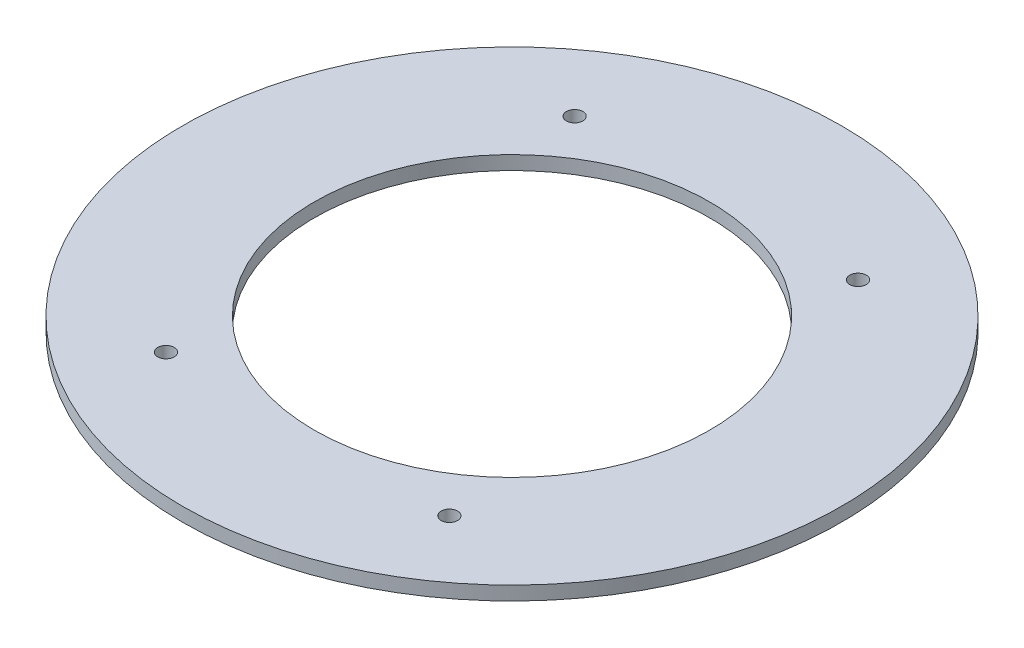
from build123d import *

# Parameters (mm, degrees)
SKETCH1_R          = 127
BASE_DEPTH         = 5.334
SKETCH2_R          = 76.2
CUT_EXTRUDE1_DEPTH = 180.684310823
HOLE2_OUTLINE_R    = 3.175
HOLE2_DEPTH        = 5.334


# Read off the part's stored shape, not the designer's step: Hole2
with BuildPart() as part:
    # Sketch1 → Base (new body)
    with BuildSketch(Plane(origin=(0, 0, 0), x_dir=(1, 0, 0), z_dir=(0, 1, 0))):
        with Locations(Location((0, 0, 0), (0, 0, 270))):
            Circle(SKETCH1_R)
    extrude(amount=BASE_DEPTH)

    # Sketch2 → Cut-Extrude1 (cut, through all)
    with BuildSketch(Plane(origin=(0, 5.334, 0), x_dir=(1, 0, 0), z_dir=(0, 1, 0))):
        with Locations(Location((0, 0, 0), (0, 0, 270))):
            Circle(SKETCH2_R)
    extrude(amount=-CUT_EXTRUDE1_DEPTH, mode=Mode.SUBTRACT)

    # Hole2 outline → Hole2 (cut)
    with BuildSketch(Plane(origin=(0, 0, 0), x_dir=(1, 0, 0), z_dir=(0, 1, 0))):
        with Locations((-54.61, -78.74)):
            Circle(HOLE2_OUTLINE_R)
        with Locations((54.61, -78.74)):
            Circle(HOLE2_OUTLINE_R)
        with Locations((54.61, 78.74)):
            Circle(HOLE2_OUTLINE_R)
        with Locations((-54.61, 78.74)):
            Circle(HOLE2_OUTLINE_R)
    extrude(amount=HOLE2_DEPTH, mode=Mode.SUBTRACT)


solid = part.part
